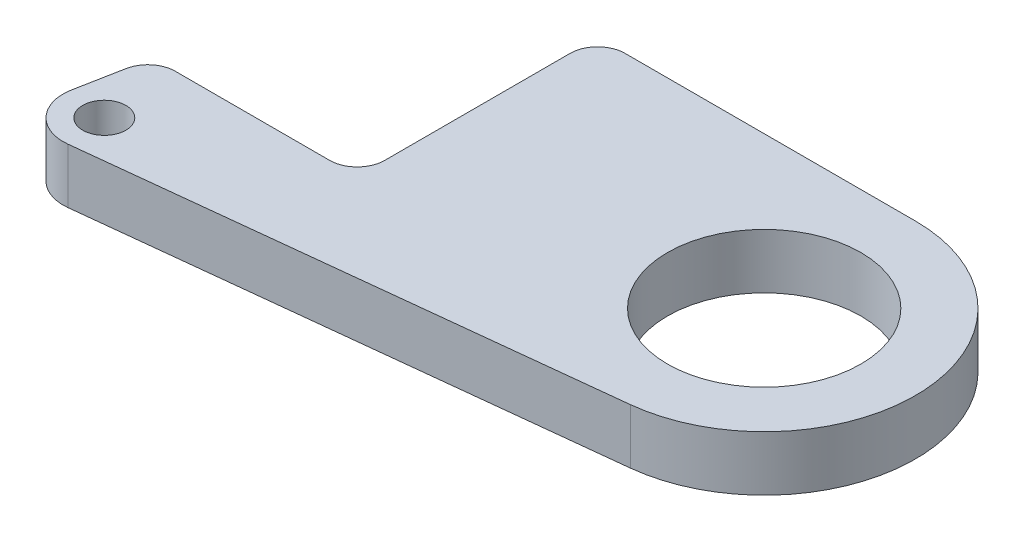
from build123d import *

# Parameters (mm, degrees)
SKETCH1_R           = 11.1633
SKETCH1_R_2         = 2
SKETCH1_R_3         = 6.35
SKETCH1_R_4         = 2.4892
BOSS_EXTRUDE1_DEPTH = 3.175
SKETCH16_R          = 2.4892
SKETCH16_R_2        = 11.1633
SKETCH16_R_3        = 2
SKETCH16_R_4        = 6.35
CUT_EXTRUDE12_DEPTH = 163.616110922
FILLET72_R          = 3.175


with BuildPart() as part:
    # Sketch1 → Boss-Extrude1 (new, symmetric)
    with BuildSketch(Plane(origin=(0, 0, 0), x_dir=(1, 0, 0), z_dir=(0, 1, 0))):
        with BuildLine():
            Line((-150.8125, 39.605), (150.8125, 39.605))
            ThreePointArc((150.8125, 39.605), (155.302628061, 37.745128061), (157.1625, 33.255))
            Line((157.1625, 33.255), (157.1625, -19.05))
            ThreePointArc((157.1625, -19.05), (155.627218445, -23.190167423), (151.763764159, -25.328343452))
            Line((151.763764159, -25.328343452), (46.988764159, -41.203343452))
            ThreePointArc((46.988764159, -41.203343452), (46.514479602, -41.257060522), (46.0375, -41.275))
            Line((46.0375, -41.275), (-46.0375, -41.275))
            ThreePointArc((-46.0375, -41.275), (-46.514479602, -41.257060522), (-46.988764159, -41.203343452))
            Line((-46.988764159, -41.203343452), (-151.763764159, -25.328343452))
            ThreePointArc((-151.763764159, -25.328343452), (-155.627218445, -23.190167423), (-157.1625, -19.05))
            Line((-157.1625, -19.05), (-157.1625, 33.255))
            ThreePointArc((-157.1625, 33.255), (-155.302628061, 37.745128061), (-150.8125, 39.605))
        make_face()
        with Locations((93.6625, 0)):
            Circle(SKETCH1_R, mode=Mode.SUBTRACT)
        with Locations((-93.6625, 0)):
            Circle(SKETCH1_R, mode=Mode.SUBTRACT)
        with Locations((-20.6375, -0.395)):
            Circle(SKETCH1_R_2, mode=Mode.SUBTRACT)
        with Locations((-20.6375, 29.605)):
            Circle(SKETCH1_R_2, mode=Mode.SUBTRACT)
        with Locations((27.550691233, -0.762)):
            Circle(SKETCH1_R, mode=Mode.SUBTRACT)
        with Locations((-13.06373698, -21.922343932)):
            Circle(SKETCH1_R, mode=Mode.SUBTRACT)
        with Locations((-20.6375, 14.605)):
            Circle(SKETCH1_R_3, mode=Mode.SUBTRACT)
        with Locations((-150.8125, 33.255)):
            Circle(SKETCH1_R_4, mode=Mode.SUBTRACT)
        with Locations((-150.8125, -19.05)):
            Circle(SKETCH1_R_4, mode=Mode.SUBTRACT)
        with Locations((46.0375, 33.255)):
            Circle(SKETCH1_R_4, mode=Mode.SUBTRACT)
        with Locations((-46.0375, 33.255)):
            Circle(SKETCH1_R_4, mode=Mode.SUBTRACT)
        with Locations((-46.0375, -34.925)):
            Circle(SKETCH1_R_4, mode=Mode.SUBTRACT)
        with Locations((46.0375, -34.925)):
            Circle(SKETCH1_R_4, mode=Mode.SUBTRACT)
        with Locations((150.8125, 33.255)):
            Circle(SKETCH1_R_4, mode=Mode.SUBTRACT)
        with Locations((150.8125, -19.05)):
            Circle(SKETCH1_R_4, mode=Mode.SUBTRACT)
    extrude(amount=BOSS_EXTRUDE1_DEPTH, both=True)

    # Sketch16 → Cut-Extrude12 (cut, through all)
    with BuildSketch(Plane(origin=(0, 3.175, 0), x_dir=(1, 0, 0), z_dir=(0, 1, 0))):
        with BuildLine():
            ThreePointArc((-150.8125, 39.605), (-155.302628061, 37.745128061), (-157.1625, 33.255))
            Line((-157.1625, 33.255), (-157.1625, -19.05))
            ThreePointArc((-157.1625, -19.05), (-155.627218445, -23.190167423), (-151.763764159, -25.328343452))
            Line((-151.763764159, -25.328343452), (-46.988764159, -41.203343452))
            ThreePointArc((-46.988764159, -41.203343452), (-46.514479602, -41.257060522), (-46.0375, -41.275))
            Line((-46.0375, -41.275), (46.0375, -41.275))
            ThreePointArc((46.0375, -41.275), (46.514479602, -41.257060522), (46.988764159, -41.203343452))
            Line((46.988764159, -41.203343452), (151.763764159, -25.328343452))
            ThreePointArc((151.763764159, -25.328343452), (155.627218445, -23.190167423), (157.1625, -19.05))
            Line((157.1625, -19.05), (157.1625, 33.255))
            ThreePointArc((157.1625, 33.255), (155.302628061, 37.745128061), (150.8125, 39.605))
            Line((150.8125, 39.605), (-150.8125, 39.605))
        make_face()
        with Locations((-46.0375, -34.925)):
            Circle(SKETCH16_R, mode=Mode.SUBTRACT)
        with Locations((-13.06373698, -21.922343932)):
            Circle(SKETCH16_R_2, mode=Mode.SUBTRACT)
        with BuildLine():
            Line((-91.756981234, -17.358222964), (-150.292813064, -23.784060808))
            ThreePointArc((-150.292813064, -23.784060808), (-154.311357637, -22.281006265), (-155.490284248, -18.155717731))
            Line((-155.490284248, -18.155717731), (-153.9875, -10.295))
            Line((-153.9875, -10.295), (-130.3625, -10.295))
            Line((-130.3625, -10.295), (-130.3625, 17.4625))
            Line((-130.3625, 17.4625), (-93.6625, 17.4625))
            ThreePointArc((-93.6625, 17.4625), (-81.314647834, 12.347852166), (-76.2, 0))
            ThreePointArc((-76.2, 0), (-80.658384734, -11.654694007), (-91.756981234, -17.358222964))
        make_face(mode=Mode.SUBTRACT)
        with Locations((46.0375, -34.925)):
            Circle(SKETCH16_R, mode=Mode.SUBTRACT)
        with Locations((150.8125, -19.05)):
            Circle(SKETCH16_R, mode=Mode.SUBTRACT)
        with Locations((-20.6375, -0.395)):
            Circle(SKETCH16_R_3, mode=Mode.SUBTRACT)
        with Locations((-20.6375, 14.605)):
            Circle(SKETCH16_R_4, mode=Mode.SUBTRACT)
        with Locations((-150.8125, 33.255)):
            Circle(SKETCH16_R, mode=Mode.SUBTRACT)
        with Locations((-46.0375, 33.255)):
            Circle(SKETCH16_R, mode=Mode.SUBTRACT)
        with Locations((-20.6375, 29.605)):
            Circle(SKETCH16_R_3, mode=Mode.SUBTRACT)
        with Locations((27.550691233, -0.762)):
            Circle(SKETCH16_R_2, mode=Mode.SUBTRACT)
        with Locations((93.6625, 0)):
            Circle(SKETCH16_R_2, mode=Mode.SUBTRACT)
        with Locations((46.0375, 33.255)):
            Circle(SKETCH16_R, mode=Mode.SUBTRACT)
        with Locations((150.8125, 33.255)):
            Circle(SKETCH16_R, mode=Mode.SUBTRACT)
    extrude(amount=-CUT_EXTRUDE12_DEPTH, mode=Mode.SUBTRACT)

    # Fillet72
    fillet72_edges = [part.edges().sort_by_distance(p)[0] for p in [
        (-130.3625, 0, -17.4625),
        (-153.9875, 0, 10.295),
        (-130.3625, 0, 10.295),
    ]]
    fillet(fillet72_edges, radius=FILLET72_R)


solid = part.part
